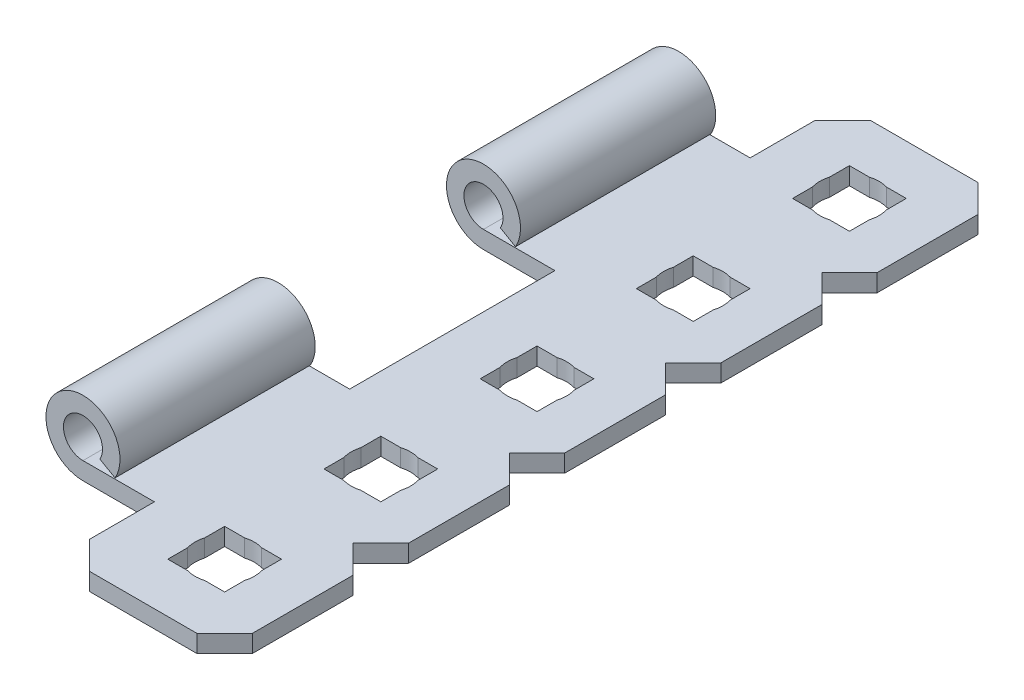
from build123d import *

# Parameters (mm, degrees)
BOSS_EXTRUDE1_DEPTH       = 15.875
BOSS_EXTRUDE1_START       = -16.6878
BOSS_EXTRUDE1_2_OUTLINE_W = 13.242442679
BOSS_EXTRUDE1_2_OUTLINE_H = 1.4224
BOSS_EXTRUDE1_2_DEPTH     = 16.6878
BOSS_EXTRUDE2_START       = 15.875
BOSS_EXTRUDE2_DEPTH       = 15.875
SKETCH3_W                 = 13.242442679
SKETCH3_H                 = 1.4224
BOSS_EXTRUDE3_DEPTH       = 7.5311
SKETCH4_W                 = 13.242442679
SKETCH4_H                 = 1.4224
BOSS_EXTRUDE4_DEPTH       = 7.5311
CUT_EXTRUDE1_DEPTH        = 38.226845626
CUT_EXTRUDE2_DEPTH        = 38.226845626
CUT_EXTRUDE3_DEPTH        = 38.226845626
CUT_EXTRUDE4_DEPTH        = 38.226845626
SKETCH9_W                 = 4.6228
SKETCH9_H                 = 4.6228
CUT_EXTRUDE5_DEPTH        = 38.429132244
SKETCH10_W                = 4.6228
SKETCH10_H                = 4.6228
CUT_EXTRUDE6_DEPTH        = 38.429132244
SKETCH11_W                = 4.6228
SKETCH11_H                = 4.6228
CUT_EXTRUDE7_DEPTH        = 38.429132244
SKETCH12_W                = 4.6228
SKETCH12_H                = 4.6228
CUT_EXTRUDE8_DEPTH        = 38.429132244
SKETCH13_W                = 4.6228
SKETCH13_H                = 4.6228
CUT_EXTRUDE9_DEPTH        = 38.226845626
DRAFT1_ANGLE              = 45
DRAFT2_ANGLE              = 45
CHAMFER1_SIZE             = 2.24506403
SKETCH14_R                = 2.413
CUT_EXTRUDE10_DEPTH       = 2.54
LPATTERN1_COUNT           = 5
LPATTERN1_PITCH           = 12.7


with BuildPart() as part:
    # Boss-Extrude1: read off the stored shape, not the designer's step
    # Boss-Extrude1 outline → Boss-Extrude1 (new body)
    with BuildSketch(Plane(origin=(0, 0, -8.3439), x_dir=(-1, 0, 0), z_dir=(0, 0, -1))):
        with BuildLine():
            ThreePointArc((15.875, 0), (17.379950004, 5.616549878), (13.26835013, 1.504950004))
            Line((13.26835013, 1.504950004), (14.500184664, 2.216150004))
            ThreePointArc((14.500184664, 2.216150004), (16.668750004, 4.384715344), (15.875, 1.4224))
            Line((15.875, 1.4224), (-3.175, 1.4224))
            Line((-3.175, 1.4224), (-3.175, 0))
            Line((-3.175, 0), (15.875, 0))
        make_face()
    extrude(amount=BOSS_EXTRUDE1_DEPTH)

    # Boss-Extrude1 2 outline → Boss-Extrude1 2 (add)
    with BuildSketch(Plane(origin=(0, 0, -8.3439), x_dir=(-1, 0, 0), z_dir=(0, 0, -1)).offset(BOSS_EXTRUDE1_START)):
        with Locations((3.44622134, 0.7112)):
            Rectangle(BOSS_EXTRUDE1_2_OUTLINE_W, BOSS_EXTRUDE1_2_OUTLINE_H)
    extrude(amount=BOSS_EXTRUDE1_2_DEPTH)

    # Sketch2 → Boss-Extrude2 (add)
    with BuildSketch(Plane.XY.offset(8.3439).offset(BOSS_EXTRUDE2_START)):
        with BuildLine():
            Line((3.175, -6e-09), (-15.875, -6e-09))
            ThreePointArc((-15.875, -6e-09), (-17.379950004, 5.616549873), (-13.26835013, 1.504949999))
            Line((-13.26835013, 1.504949999), (-14.500184664, 2.216149999))
            ThreePointArc((-14.500184664, 2.216149999), (-16.668750004, 4.384715339), (-15.875, 1.422399994))
            Line((-15.875, 1.422399994), (3.175, 1.422399994))
            Line((3.175, 1.422399994), (3.175, -6e-09))
        make_face()
    extrude(amount=-BOSS_EXTRUDE2_DEPTH)

    # Sketch3 → Boss-Extrude3 (add)
    with BuildSketch(Plane(origin=(0, 0, -24.2189), x_dir=(-1, 0, 0), z_dir=(0, 0, -1))):
        with Locations((3.44622134, 0.7112)):
            Rectangle(SKETCH3_W, SKETCH3_H)
    extrude(amount=BOSS_EXTRUDE3_DEPTH)

    # Sketch4 → Boss-Extrude4 (add)
    with BuildSketch(Plane.XY.offset(24.2189)):
        with Locations((-3.44622134, 0.7112)):
            Rectangle(SKETCH4_W, SKETCH4_H)
    extrude(amount=BOSS_EXTRUDE4_DEPTH)

    # Sketch5 → Cut-Extrude1 (cut, through all)
    with BuildSketch(Plane(origin=(0, 1.4224, 0), x_dir=(-1, 0, 0), z_dir=(0, 1, 0))):
        Polygon((-3.175, -16.80493597), (-3.175, -21.29506403), (1.315128061, -16.80493597), align=None)
    extrude(amount=-CUT_EXTRUDE1_DEPTH, mode=Mode.SUBTRACT)

    # Sketch6 → Cut-Extrude2 (cut, through all)
    with BuildSketch(Plane(origin=(0, 1.4224, 0), x_dir=(-1, 0, 0), z_dir=(0, 1, 0))):
        Polygon((-3.175, -4.10493597), (-3.175, -8.59506403), (1.315128061, -8.59506403), align=None)
    extrude(amount=-CUT_EXTRUDE2_DEPTH, mode=Mode.SUBTRACT)

    # Sketch7 → Cut-Extrude3 (cut, through all)
    with BuildSketch(Plane(origin=(0, 1.4224, 0), x_dir=(-1, 0, 0), z_dir=(0, 1, 0))):
        Polygon((-3.175, 8.59506403), (-3.175, 4.10493597), (1.315128061, 8.59506403), align=None)
    extrude(amount=-CUT_EXTRUDE3_DEPTH, mode=Mode.SUBTRACT)

    # Sketch8 → Cut-Extrude4 (cut, through all)
    with BuildSketch(Plane(origin=(0, 1.4224, 0), x_dir=(-1, 0, 0), z_dir=(0, 1, 0))):
        Polygon((-3.175, 21.29506403), (-3.175, 16.80493597), (1.315128061, 16.80493597), align=None)
    extrude(amount=-CUT_EXTRUDE4_DEPTH, mode=Mode.SUBTRACT)

    # Sketch9 → Cut-Extrude5 (cut, through all)
    with BuildSketch(Plane.XZ):
        with Locations((-3.175, 25.4)):
            Rectangle(SKETCH9_W, SKETCH9_H)
    extrude(amount=-CUT_EXTRUDE5_DEPTH, mode=Mode.SUBTRACT)

    # Sketch10 → Cut-Extrude6 (cut, through all)
    with BuildSketch(Plane.XZ):
        with Locations((-3.175, 12.7)):
            Rectangle(SKETCH10_W, SKETCH10_H)
    extrude(amount=-CUT_EXTRUDE6_DEPTH, mode=Mode.SUBTRACT)

    # Sketch11 → Cut-Extrude7 (cut, through all)
    with BuildSketch(Plane.XZ):
        with Locations((-3.175, 0)):
            Rectangle(SKETCH11_W, SKETCH11_H)
    extrude(amount=-CUT_EXTRUDE7_DEPTH, mode=Mode.SUBTRACT)

    # Sketch12 → Cut-Extrude8 (cut, through all)
    with BuildSketch(Plane.XZ):
        with Locations((-3.175, -12.7)):
            Rectangle(SKETCH12_W, SKETCH12_H)
    extrude(amount=-CUT_EXTRUDE8_DEPTH, mode=Mode.SUBTRACT)

    # Sketch13 → Cut-Extrude9 (cut, through all)
    with BuildSketch(Plane(origin=(0, 1.4224, 0), x_dir=(-1, 0, 0), z_dir=(0, 1, 0))):
        with Locations((3.175, -25.4)):
            Rectangle(SKETCH13_W, SKETCH13_H)
    extrude(amount=-CUT_EXTRUDE9_DEPTH, mode=Mode.SUBTRACT)

    # Draft1
    draft1_faces = [part.faces().sort_by_distance(p)[0] for p in [
        (0.92993597, 0.7112, -8.59506403),
        (0.92993597, 0.711199999, -16.80493597),
    ]]
    draft(draft1_faces, Plane(origin=(3.175, 0, 31.75), x_dir=(0, 0, 1), z_dir=(1, 0, 0)), DRAFT1_ANGLE)

    # Draft2
    draft2_faces = [part.faces().sort_by_distance(p)[0] for p in [
        (0.92993597, 0.7112, 16.80493597),
        (0.92993597, 0.711199997, 8.59506403),
    ]]
    draft(draft2_faces, Plane(origin=(3.175, 0, 31.75), x_dir=(0, 0, 1), z_dir=(1, 0, 0)), DRAFT2_ANGLE)

    # Chamfer1
    chamfer1_edges = [part.edges().sort_by_distance(p)[0] for p in [
        (3.175, 0.7112, 31.75),
        (-10.067442679, 0.7112, 31.75),
        (3.175, 0.7112, -31.75),
        (-10.067442679, 0.7112, -31.75),
    ]]
    chamfer(chamfer1_edges, length=CHAMFER1_SIZE)

    # Sketch14 → Cut-Extrude10 (cut)
    with BuildSketch(Plane(origin=(0, 1.4224, 0), x_dir=(1, 0, 0), z_dir=(0, 1, 0))):
        with Locations((-3.175, -25.4)):
            Circle(SKETCH14_R)
    cut_extrude10 = extrude(amount=-CUT_EXTRUDE10_DEPTH, mode=Mode.SUBTRACT)

    # LPattern1: Cut-Extrude10 ×5
    with Locations(*[(0, 0, -i * LPATTERN1_PITCH) for i in range(1, LPATTERN1_COUNT)]):
        add(cut_extrude10, mode=Mode.SUBTRACT)


solid = part.part
